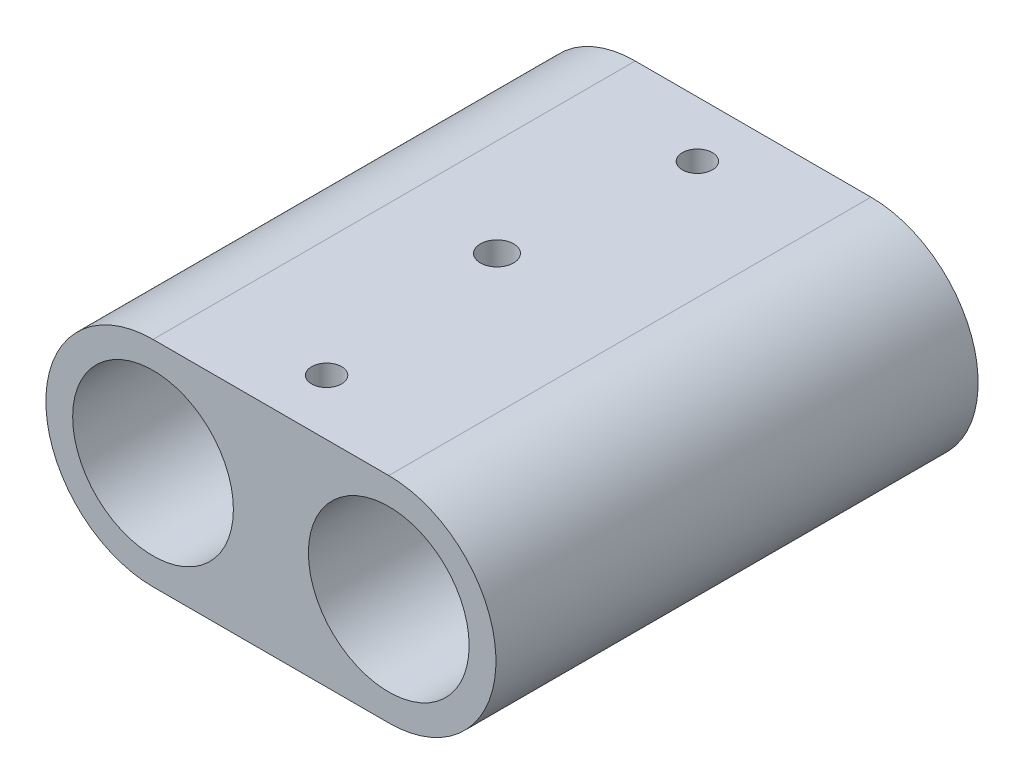
from build123d import *
from build123d.topology import SkipClean

# Parameters (mm, degrees)
SKETCH_1_R           = 7.5
EXTRUDE_1_DEPTH      = 37
SKETCH_6_R           = 2.75
CUT_EXTRUDE_3_DEPTH  = 5.5
SKETCH_8_R           = 1.55
CUT_EXTRUDE_6_DEPTH  = 45.947191236
CHAMFER_1_SIZE       = 1.2
SKETCH_12_R          = 1.3
CUT_EXTRUDE_8_DEPTH  = 5
SKETCH_17_R          = 7.5
EXTRUDE_5_DEPTH      = 4
EXTRUDE_START        = 4
SKETCH_18_R          = 7.5
EXTRUDE_6_DEPTH      = 4
SKETCH_19_R          = 1.4
CUT_EXTRUDE_12_DEPTH = 51.219518118
SKETCH_20_R          = 2.75
CUT_EXTRUDE_14_DEPTH = 3


with BuildPart() as part:
    # Эскиз1 → Бобышка-Вытянуть1 (new body)
    with BuildSketch(Plane.XY):
        with BuildLine():
            Line((-11, 10), (11, 10))
            ThreePointArc((11, 10), (21, 0), (11, -10))
            Line((11, -10), (-11, -10))
            ThreePointArc((-11, -10), (-21, 0), (-11, 10))
        make_face()
        with Locations((-11, 0)):
            Circle(SKETCH_1_R, mode=Mode.SUBTRACT)
        with Locations((11, 0)):
            Circle(SKETCH_1_R, mode=Mode.SUBTRACT)
    extrude(amount=EXTRUDE_1_DEPTH)

    # Эскиз6 → Вырез-Вытянуть3 (cut)
    with BuildSketch(Plane.XZ.offset(10)):
        with Locations((-1.9, 18)):
            Circle(SKETCH_6_R)
    extrude(amount=-CUT_EXTRUDE_3_DEPTH, mode=Mode.SUBTRACT)

    # Эскиз8 → Вырез-Вытянуть6 (cut, through all)
    with BuildSketch(Plane.XZ.offset(4.5)):
        with Locations((-1.9, 18)):
            Circle(SKETCH_8_R)
    extrude(amount=-CUT_EXTRUDE_6_DEPTH, mode=Mode.SUBTRACT)

    # Фаска1
    chamfer_1_edges = [part.edges().sort_by_distance(p)[0] for p in [
        (-3.45, -4.5, 18),
    ]]
    chamfer(chamfer_1_edges, length=CHAMFER_1_SIZE - 0.0001)  # a hair under: the kernel refuses the full size

    # Эскиз12 → Вырез-Вытянуть8 (cut)
    with BuildSketch(Plane.XZ.offset(10)):
        with Locations((-4, 32.5)):
            Circle(SKETCH_12_R)
        with Locations((4, 4.5)):
            Circle(SKETCH_12_R)
    extrude(amount=-CUT_EXTRUDE_8_DEPTH, mode=Mode.SUBTRACT)

    # Эскиз17 → Бобышка-Вытянуть5 (add)
    with BuildSketch(Plane.XY.offset(37)):
        with BuildLine():
            Line((-11, 10), (11, 10))
            ThreePointArc((11, 10), (21, 0), (11, -10))
            Line((11, -10), (-11, -10))
            ThreePointArc((-11, -10), (-21, 0), (-11, 10))
        make_face()
        with Locations((-11, 0)):
            Circle(SKETCH_17_R, mode=Mode.SUBTRACT)
        with Locations((11, 0)):
            Circle(SKETCH_17_R, mode=Mode.SUBTRACT)
    extrude(amount=EXTRUDE_5_DEPTH)

    # Эскиз18 → Бобышка-Вытянуть6 (add)
    with SkipClean():  # the faces are left unmerged after this step: merging them gives an invalid solid
        with BuildSketch(Plane(origin=(0, 0, 0), x_dir=(-1, 0, 0), z_dir=(0, 0, -1)).offset(EXTRUDE_START)):
            with BuildLine():
                Line((-11, 10), (11, 10))
                ThreePointArc((11, 10), (21, 0), (11, -10))
                Line((11, -10), (-11, -10))
                ThreePointArc((-11, -10), (-21, 0), (-11, 10))
            make_face()
            with Locations((-11, 0)):
                Circle(SKETCH_18_R, mode=Mode.SUBTRACT)
            with Locations((11, 0)):
                Circle(SKETCH_18_R, mode=Mode.SUBTRACT)
        extrude(amount=-EXTRUDE_6_DEPTH)

    # Эскиз19 → Вырез-Вытянуть12 (cut, through all)
    with SkipClean():  # the faces are left unmerged after this step: merging them gives an invalid solid
        with BuildSketch(Plane(origin=(0, 10, 0), x_dir=(1, 0, 0), z_dir=(0, 1, 0))):
            with Locations(Location((0, -1.2, 0), (0, 0, 180))):
                Circle(SKETCH_19_R)
            with Locations(Location((0, -35.8, 0), (0, 0, 180))):
                Circle(SKETCH_19_R)
        extrude(amount=-CUT_EXTRUDE_12_DEPTH, mode=Mode.SUBTRACT)

    # Эскиз20 → Вырез-Вытянуть14 (cut)
    with SkipClean():  # the faces are left unmerged after this step: merging them gives an invalid solid
        with BuildSketch(Plane(origin=(0, -10, 0), x_dir=(-1, 0, 0), z_dir=(0, -1, 0))):
            with Locations(Location((0, -35.8, 0), (0, 0, 180))):
                Circle(SKETCH_20_R)
            with Locations(Location((0, -1.2, 0), (0, 0, 180))):
                Circle(SKETCH_20_R)
        extrude(amount=-CUT_EXTRUDE_14_DEPTH, mode=Mode.SUBTRACT)


solid = part.part
